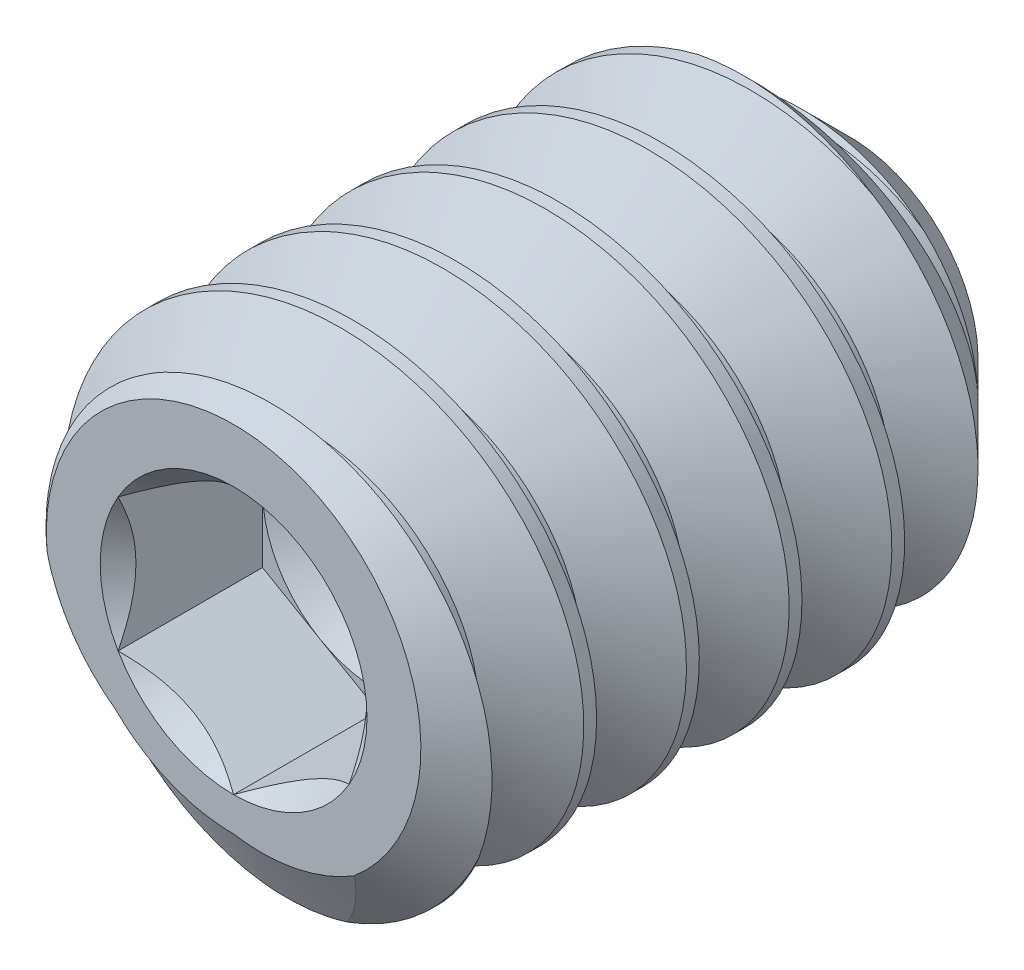
from build123d import *

# Parameters (mm, degrees)
CUT_SWEEP2_PITCH    = 1.058333333
CUT_EXTRUDE10_DEPTH = 1.48828125


with BuildPart() as part:
    # Sketch22 → Revolve1 (revolve)
    with BuildSketch(Plane(origin=(0, 0, 0), x_dir=(0, 0, -1), z_dir=(1, 0, 0)), mode=Mode.PRIVATE) as revolve1_sk:
        Polygon((-2.777759232, 0), (-2.777759232, 1.9304), (-2.439839074, 2.413), (2.481480087, 2.413), (3.572240768, 1.322239319), (3.572240768, 0), (2.777759232, 0), align=None)
    revolve(revolve1_sk.sketch.rotate(Axis((0, 0, -2.777759232), (0, 0, -1)), 180), axis=Axis((0, 0, -2.777759232), (0, 0, -1)))

    # Cut-Sweep2: the profile of Sketch28 profile screwed along a right-hand helix of 7 turns, 8 arcs to a turn; built about Z, then put on its axis
    cut_sweep2_z = Axis((0, 0, 0), (0, 0, 1))
    cut_sweep2_corners = [(2.4133, 0, 0.000173205), (2.4133, 0, -0.926214872), (1.725592336, 0, -0.529166667), (1.725592336, 0, -0.396875)]
    with BuildLine(mode=Mode.PRIVATE) as cut_sweep2_profile:
        Line(cut_sweep2_corners[0], cut_sweep2_corners[1])
        Line(cut_sweep2_corners[1], cut_sweep2_corners[2])
        Line(cut_sweep2_corners[2], cut_sweep2_corners[3])
        Line(cut_sweep2_corners[3], cut_sweep2_corners[0])
    cut_sweep2_cap = Face(cut_sweep2_profile.wire())
    cut_sweep2_turn_angles = [0, 22.5, 45, 67.5, 90, 112.5, 135, 157.5, 180, 202.5, 225, 247.5, 270, 292.5, 315, 337.5, 360]
    cut_sweep2_turn_weights = [1, 0.9238795325112867, 1, 0.9238795325112867, 1, 0.9238795325112867, 1, 0.9238795325112867, 1, 0.9238795325112867, 1, 0.9238795325112867, 1, 0.9238795325112867, 1, 0.9238795325112867, 1]
    cut_sweep2_turn_rails = [Edge.make_bspline([Vector(p[0], p[1], 0).rotate(cut_sweep2_z, cut_sweep2_turn_angles[k]) / cut_sweep2_turn_weights[k] + Vector(0, 0, p[2] + CUT_SWEEP2_PITCH * cut_sweep2_turn_angles[k] / 360) for k in range(17)], [0, 0, 0, 1, 1, 2, 2, 3, 3, 4, 4, 5, 5, 6, 6, 7, 7, 8, 8, 8], 2, cut_sweep2_turn_weights) for p in cut_sweep2_corners]
    cut_sweep2_turn_sides = [Face.make_surface_from_curves(cut_sweep2_turn_rails[p[0]], cut_sweep2_turn_rails[p[1]]) for p in [(0, 1), (1, 2), (2, 3), (3, 0)]]
    cut_sweep2 = Plane(origin=(0, 0, -3.572240768), x_dir=(0, 1, 0), z_dir=(0, 0, 1)) * Solid(Shell([*[p.moved(Location((0, 0, CUT_SWEEP2_PITCH * i))) for i in range(7) for p in cut_sweep2_turn_sides], cut_sweep2_cap, cut_sweep2_cap.rotate(cut_sweep2_z, 2520).moved(Location((0, 0, CUT_SWEEP2_PITCH * 2520 / 360)))]))
    add(cut_sweep2, mode=Mode.SUBTRACT)

    # Sketch23 → Cut-Extrude10 (cut)
    with BuildSketch(Plane.XY.offset(2.777759232)):
        Polygon((0, 1.374815329), (-1.190625, 0.687407664), (-1.190625, -0.687407664), (0, -1.374815329), (1.190625, -0.687407664), (1.190625, 0.687407664), align=None)
    extrude(amount=-CUT_EXTRUDE10_DEPTH, mode=Mode.SUBTRACT)

    # Cut-Extrude11 cone 1 section (through the dimple's axis) → Cut-Extrude11 (revolve, cut)
    with BuildSketch(Plane(origin=(0, 0, 2.777759232), x_dir=(0, -1, 0), z_dir=(1, 0, 0))):
        Polygon((0, 0), (1.374815329, 0), (0, 1.374815329), align=None)
    revolve(axis=Axis((0, 0, 2.777759232), (0, 0, -1)), mode=Mode.SUBTRACT)

    # Cut-Extrude12 cone 1 section (through the dimple's axis) → Cut-Extrude12 (revolve, cut)
    with BuildSketch(Plane(origin=(0, 0, 1.289477982), x_dir=(0, -1, 0), z_dir=(1, 0, 0))):
        Polygon((0, 0), (1.190625, 0), (0, 0.687407664), align=None)
    revolve(axis=Axis((0, 0, 1.289477982), (0, 0, -1)), mode=Mode.SUBTRACT)


solid = part.part
